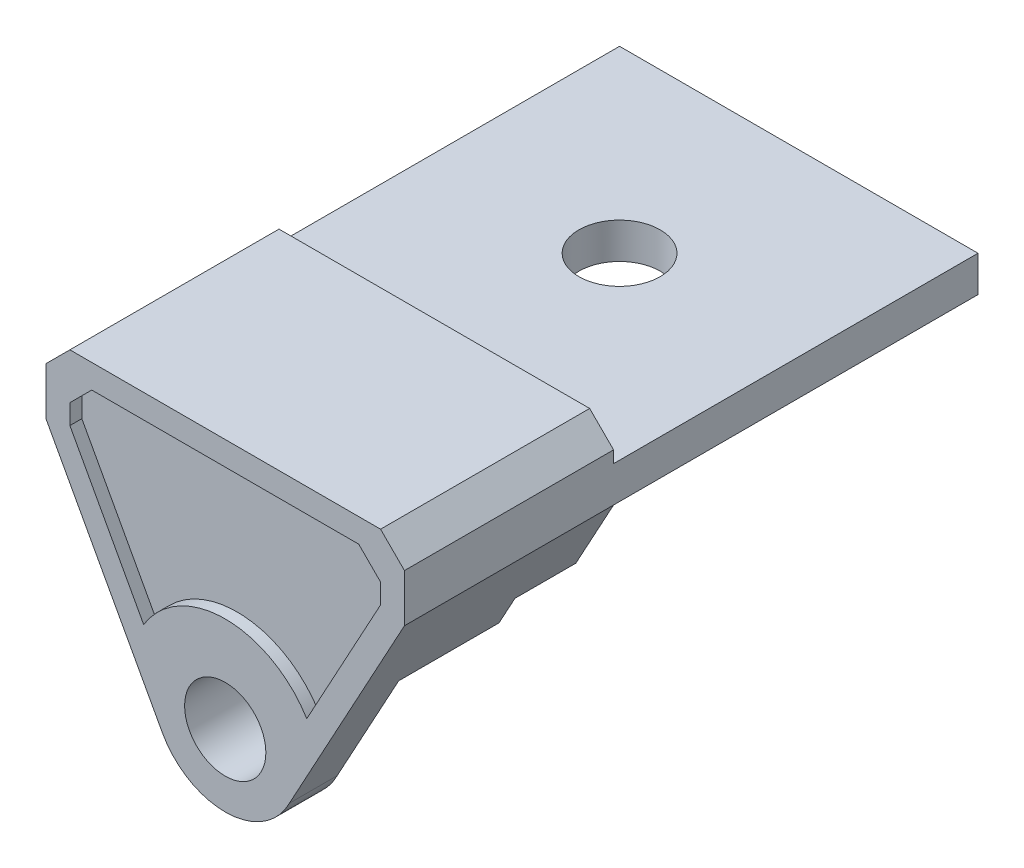
from build123d import *
from build123d.topology import SkipClean

# Parameters (mm, degrees)
BOSS_EXTRUDE1_DEPTH    = 2
BOSS_EXTRUDE2_START    = 4.75
BOSS_EXTRUDE2_DEPTH    = 4.75
BOSS_EXTRUDE3_START    = 2
SKETCH3_R              = 3
SKETCH3_R_2            = 1.7
BOSS_EXTRUDE3_DEPTH    = 2
SKETCH4_R              = 2.2
SKETCH4_R_2            = 1.7
BOSS_EXTRUDE4_DEPTH    = 0.5
CHAMFER1_SIZE          = 0.5
SKETCH5_W              = 7.5
SKETCH5_H              = 3
BOSS_EXTRUDE5_DEPTH    = 2
BOSS_EXTRUDE6_DEPTH    = 4.2
BOSS_EXTRUDE8_DEPTH    = 6.75
SKETCH10_W             = 15
SKETCH10_H             = 3
BOSS_EXTRUDE9_DEPTH    = 15.25
SKETCH11_R             = 1.65
CUT_EXTRUDE1_DEPTH     = 22.542109925
FILLET1_R              = 0.2
BOSS_EXTRUDE12_REACH   = 29.249
SKETCH16_W             = 15
SKETCH16_H             = 1.5
CUT_EXTRUDE3_DEPTH     = 0.5
CUT_EXTRUDE4_START     = -15.25
CUT_EXTRUDE4_OUTLINE_W = 15
CUT_EXTRUDE4_OUTLINE_H = 1.5
CUT_EXTRUDE4_DEPTH     = 15.25
CUT_EXTRUDE4_START_2   = -24
CUT_EXTRUDE4_2_DEPTH   = 8.75
SKETCH18_R             = 1.7
CUT_EXTRUDE5_DEPTH     = 10


# Read off the part's stored shape, not the designer's step: Cut-Extrude4
with BuildPart() as part:
    # Sketch1 → Boss-Extrude1 (new body)
    with BuildSketch(Plane.XY):
        with BuildLine():
            Line((4.594082841, 4.876925553), (5.159993549, 5.442836262))
            ThreePointArc((5.159993549, 5.442836262), (0, 7.5), (-5.159993549, 5.442836262))
            Line((-5.159993549, 5.442836262), (-4.594082841, 4.876925553))
            ThreePointArc((-4.594082841, 4.876925553), (0, 6.7), (4.594082841, 4.876925553))
        make_face()
    extrude(amount=-BOSS_EXTRUDE1_DEPTH)

    # Sketch1<3> → Boss-Extrude2 (add)
    with BuildSketch(Plane.XY.offset(BOSS_EXTRUDE2_START)):
        with BuildLine():
            Line((4.594082841, 4.876925553), (5.159993549, 5.442836262))
            ThreePointArc((5.159993549, 5.442836262), (0, 7.5), (-5.159993549, 5.442836262))
            Line((-5.159993549, 5.442836262), (-4.594082841, 4.876925553))
            ThreePointArc((-4.594082841, 4.876925553), (0, 6.7), (4.594082841, 4.876925553))
        make_face()
    extrude(amount=-BOSS_EXTRUDE2_DEPTH)

    # Sketch3 → Boss-Extrude3 (add)
    # profile 1 of 4: a face of its own
    with BuildSketch(Plane.XY.offset(4.75).offset(BOSS_EXTRUDE3_START)):
        with BuildLine():
            Line((-4.594082841, 4.876925553), (-5.159993549, 5.442836262))
            Line((-5.159993549, 5.442836262), (-2.820975701, -1.02083108))
            ThreePointArc((-2.820975701, -1.02083108), (-2.892694114, 0.795185994), (-1.902774006, 2.31936437))
            Line((-1.902774006, 2.31936437), (-2.780654635, 4.745309242))
            ThreePointArc((-2.780654635, 4.745309242), (0, 5.5), (2.780654635, 4.745309242))
            Line((2.780654635, 4.745309242), (1.902774006, 2.31936437))
            ThreePointArc((1.902774006, 2.31936437), (2.711855639, 1.282902565), (3, 0))
            ThreePointArc((3, 0), (2.954904999, -0.518205025), (2.820975701, -1.02083108))
            Line((2.820975701, -1.02083108), (5.159993549, 5.442836262))
            Line((5.159993549, 5.442836262), (4.594082841, 4.876925553))
            ThreePointArc((4.594082841, 4.876925553), (0, 6.7), (-4.594082841, 4.876925553))
        make_face()
    # profile 2 of 4: a face of its own
    with BuildSketch(Plane.XY.offset(4.75).offset(BOSS_EXTRUDE3_START)):
        with BuildLine():
            Line((-5.159993549, 5.442836262), (-4.594082841, 4.876925553))
            ThreePointArc((-4.594082841, 4.876925553), (0, 6.7), (4.594082841, 4.876925553))
            Line((4.594082841, 4.876925553), (5.159993549, 5.442836262))
            ThreePointArc((5.159993549, 5.442836262), (0, 7.5), (-5.159993549, 5.442836262))
        make_face()
    # profile 3 of 4: a face of its own
    with BuildSketch(Plane.XY.offset(4.75).offset(BOSS_EXTRUDE3_START)):
        Circle(SKETCH3_R)
        Circle(SKETCH3_R_2, mode=Mode.SUBTRACT)
    # profile 4 of 4: a face of its own
    with BuildSketch(Plane.XY.offset(4.75).offset(BOSS_EXTRUDE3_START)):
        with BuildLine():
            Line((-2.780654635, 4.745309242), (-1.902774006, 2.31936437))
            ThreePointArc((-1.902774006, 2.31936437), (0, 3), (1.902774006, 2.31936437))
            Line((1.902774006, 2.31936437), (2.780654635, 4.745309242))
            ThreePointArc((2.780654635, 4.745309242), (0, 5.5), (-2.780654635, 4.745309242))
        make_face()
    extrude(amount=-BOSS_EXTRUDE3_DEPTH)

    # Sketch4 → Boss-Extrude4 (add)
    with SkipClean():  # the faces are left unmerged after this step: merging them gives an invalid solid
        with BuildSketch(Plane(origin=(0, 0, 4.75), x_dir=(-1, 0, 0), z_dir=(0, 0, -1))):
            with Locations(Location((0, 0, 0), (0, 0, 180))):
                Circle(SKETCH4_R)
            Circle(SKETCH4_R_2, mode=Mode.SUBTRACT)
        extrude(amount=BOSS_EXTRUDE4_DEPTH)
    add(part.part.scale(1), mode=Mode.REPLACE)  # the faces are merged on a copy

    # Chamfer1
    chamfer1_edges = [part.edges().sort_by_distance(p)[0] for p in [
        (-2.2, 0, 4.75),
    ]]
    chamfer(chamfer1_edges, length=CHAMFER1_SIZE - 0.0001)  # a hair under: the kernel refuses the full size

    # Sketch5 → Boss-Extrude5 (add)
    with BuildSketch(Plane.XY.offset(6.75)):
        with BuildLine():
            ThreePointArc((-5.159993549, 5.442836262), (-2.777474396, 6.966752183), (0, 7.5))
            Line((0, 7.5), (-7.5, 7.5))
            Line((-7.5, 7.5), (-2.634698995, -1.434698995))
            ThreePointArc((-2.634698995, -1.434698995), (-2.735675101, -1.231292711), (-2.820975701, -1.02083108))
            Line((-2.820975701, -1.02083108), (-5.159993549, 5.442836262))
        make_face()
        with Locations((-3.75, 9)):
            Rectangle(SKETCH5_W, SKETCH5_H)
        with Locations((3.75, 9)):
            Rectangle(SKETCH5_W, SKETCH5_H)
        with BuildLine():
            Line((7.5, 7.5), (0, 7.5))
            ThreePointArc((0, 7.5), (2.777474396, 6.966752183), (5.159993549, 5.442836262))
            Line((5.159993549, 5.442836262), (2.820975701, -1.02083108))
            ThreePointArc((2.820975701, -1.02083108), (2.756369418, -1.184241374), (2.682306676, -1.343588812))
            Line((2.682306676, -1.343588812), (7.5, 7.5))
        make_face()
    extrude(amount=-BOSS_EXTRUDE5_DEPTH)

    # Sketch6 → Boss-Extrude6 (add)
    with SkipClean():  # the faces are left unmerged after this step: merging them gives an invalid solid
        with BuildSketch(Plane(origin=(0, 0, 4.75), x_dir=(-1, 0, 0), z_dir=(0, 0, -1))):
            with BuildLine():
                Line((-5.921621025, 4.602651891), (-5.499242594, 3.827313795))
                ThreePointArc((-5.499242594, 3.827313795), (-5.073876801, 4.375588441), (-4.594082841, 4.876925553))
                Line((-4.594082841, 4.876925553), (-5.159993549, 5.442836262))
                ThreePointArc((-5.159993549, 5.442836262), (-5.556709713, 5.037159632), (-5.921621025, 4.602651891))
            make_face()
            with BuildLine():
                Line((5.159993549, 5.442836262), (4.594082841, 4.876925553))
                ThreePointArc((4.594082841, 4.876925553), (5.074143899, 4.375278699), (5.499709828, 3.826642367))
                Line((5.499709828, 3.826642367), (5.922007367, 4.602154794))
                ThreePointArc((5.922007367, 4.602154794), (5.556921127, 5.036926403), (5.159993549, 5.442836262))
            make_face()
            with BuildLine():
                Line((-5.499242594, 3.827313795), (-5.256310338, 3.381375701))
                ThreePointArc((-5.256310338, 3.381375701), (-4.806527723, 3.994970744), (-4.285525038, 4.549370852))
                Line((-4.285525038, 4.549370852), (-4.594082841, 4.876925553))
                ThreePointArc((-4.594082841, 4.876925553), (-5.073876801, 4.375588441), (-5.499242594, 3.827313795))
            make_face()
            with BuildLine():
                Line((4.594082841, 4.876925553), (4.275732705, 4.558575417))
                ThreePointArc((4.275732705, 4.558575417), (4.802528974, 3.999776925), (5.256816116, 3.380589346))
                Line((5.256816116, 3.380589346), (5.499709828, 3.826642367))
                ThreePointArc((5.499709828, 3.826642367), (5.074143899, 4.375278699), (4.594082841, 4.876925553))
            make_face()
        extrude(amount=BOSS_EXTRUDE6_DEPTH)

    # Sketch8 → Boss-Extrude8 (add)
    with BuildSketch(Plane(origin=(0, 0, 4.75), x_dir=(-1, 0, 0), z_dir=(0, 0, -1))):
        with BuildLine():
            Line((5.922007367, 4.602154794), (7.5, 7.5))
            Line((7.5, 7.5), (7.5, 10.5))
            Line((7.5, 10.5), (-7.5, 10.5))
            Line((-7.5, 10.5), (-7.5, 7.5))
            Line((-7.5, 7.5), (-5.921621025, 4.602651891))
            ThreePointArc((-5.921621025, 4.602651891), (0.000314788, 7.499999993), (5.922007367, 4.602154794))
        make_face()
    extrude(amount=BOSS_EXTRUDE8_DEPTH)

    # Sketch10 → Boss-Extrude9 (add)
    with BuildSketch(Plane(origin=(0, 0, -2), x_dir=(-1, 0, 0), z_dir=(0, 0, -1))):
        with Locations((0, 9)):
            Rectangle(SKETCH10_W, SKETCH10_H)
    extrude(amount=BOSS_EXTRUDE9_DEPTH)

    # Sketch11 → Cut-Extrude1 (cut, through all)
    with BuildSketch(Plane.XZ.offset(-7.5)):
        with Locations(Location((0, -9.75, 0), (0, 0, 270))):
            Circle(SKETCH11_R)
    extrude(amount=-CUT_EXTRUDE1_DEPTH, mode=Mode.SUBTRACT)

    # Fillet1
    fillet1_edges = [part.edges().sort_by_distance(p)[0] for p in [
        (4.285525038, 4.549370852, 2.65),
        (-4.275732705, 4.558575417, 2.65),
    ]]
    fillet(fillet1_edges, radius=FILLET1_R)

    # Boss-Extrude12: up to this face of the body (flat: up to its plane)
    boss_extrude12_end = Plane(part.part.faces().sort_by_distance((-0.000288638, 5.532557353, 6.75))[0])
    # Sketch16 → Boss-Extrude12 (add, up to the picked face)
    with BuildSketch(Plane(origin=(0, 0, -17.25), x_dir=(-1, 0, 0), z_dir=(0, 0, -1)), mode=Mode.PRIVATE) as boss_extrude12_sk1:
        with Locations((0, 9.75)):
            Rectangle(SKETCH16_W, SKETCH16_H)
    boss_extrude12_tool1 = split(extrude(boss_extrude12_sk1.sketch, amount=-BOSS_EXTRUDE12_REACH, mode=Mode.PRIVATE), bisect_by=boss_extrude12_end, keep=Keep.BOTH, mode=Mode.PRIVATE)
    add(boss_extrude12_tool1.solids().sort_by(Axis((0, 9.75, -17.25), (0, 0, 1)))[0])

    # Sketch13 → Cut-Extrude3 (cut)
    with BuildSketch(Plane.XY.offset(6.75)):
        with BuildLine():
            ThreePointArc((3.4124071, 2.086978147), (-0.000677338, 3.999999943), (-3.413113698, 2.085822351))
            Line((-3.413113698, 2.085822351), (-6.5, 7.754618569))
            Line((-6.5, 7.754618569), (-6.5, 8.585786438))
            Line((-6.5, 8.585786438), (-5.585786438, 9.5))
            Line((-5.585786438, 9.5), (5.585786438, 9.5))
            Line((5.585786438, 9.5), (6.5, 8.585786438))
            Line((6.5, 8.585786438), (6.5, 7.754711685))
            Line((6.5, 7.754711685), (3.4124071, 2.086978147))
        make_face()
    extrude(amount=-CUT_EXTRUDE3_DEPTH, mode=Mode.SUBTRACT)

    # Cut-Extrude4 outline → Cut-Extrude4 (cut)
    with BuildSketch(Plane(origin=(0, 0, -17.25), x_dir=(-1, 0, 0), z_dir=(0, 0, -1)).offset(CUT_EXTRUDE4_START)):
        with Locations((0, 9.75)):
            Rectangle(CUT_EXTRUDE4_OUTLINE_W, CUT_EXTRUDE4_OUTLINE_H)
    extrude(amount=CUT_EXTRUDE4_DEPTH, mode=Mode.SUBTRACT)

    # Cut-Extrude4 2 outline → Cut-Extrude4 2 (cut)
    with BuildSketch(Plane(origin=(0, 0, -17.25), x_dir=(-1, 0, 0), z_dir=(0, 0, -1)).offset(CUT_EXTRUDE4_START_2)):
        Polygon((-7.5, 10.5), (-7.5, 9.5), (-6.5, 10.5), align=None)
        Polygon((7.5, 10.5), (6.5, 10.5), (7.5, 9.5), align=None)
    extrude(amount=CUT_EXTRUDE4_2_DEPTH, mode=Mode.SUBTRACT)

    # Sketch18 → Cut-Extrude5 (cut)
    with BuildSketch(Plane(origin=(0, 10.5, 0), x_dir=(1, 0, 0), z_dir=(0, 1, 0))):
        with Locations(Location((0, 9.75, 0), (0, 0, 90))):
            Circle(SKETCH18_R)
    extrude(amount=-CUT_EXTRUDE5_DEPTH, mode=Mode.SUBTRACT)


solid = part.part
